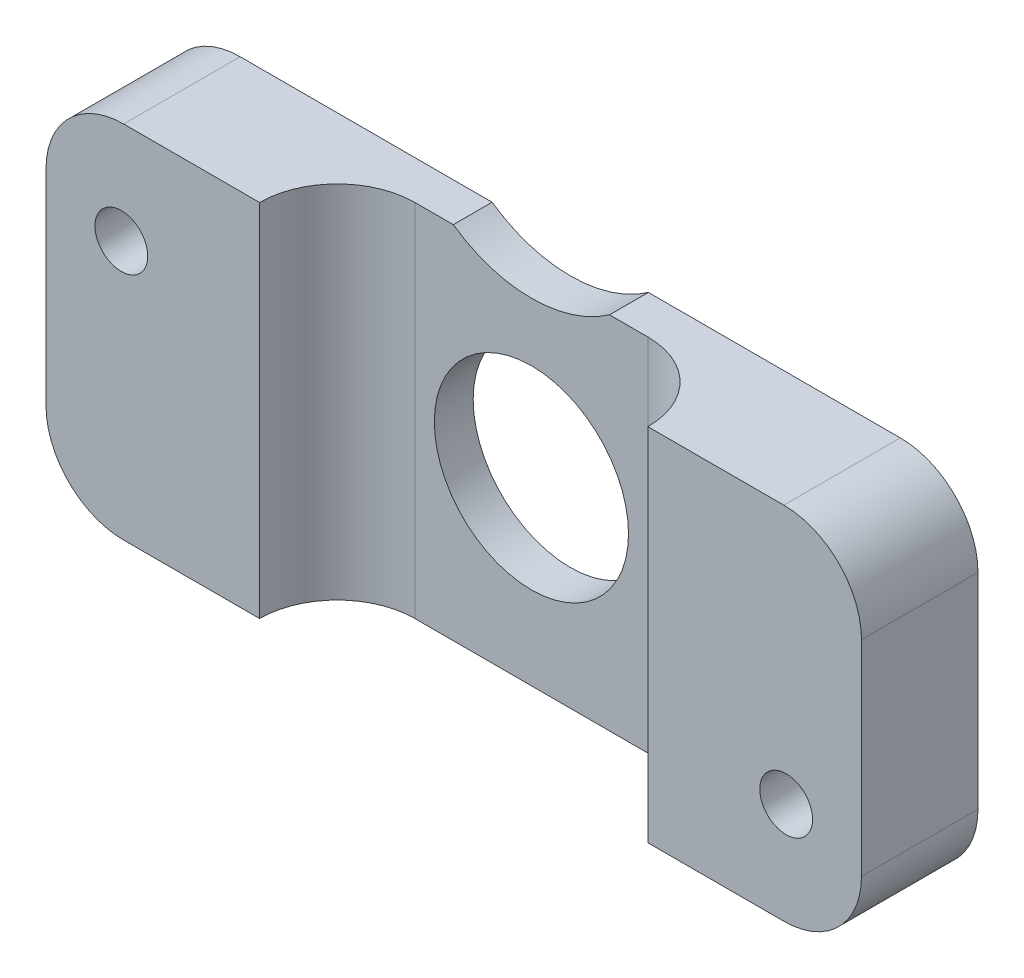
from build123d import *

# Parameters (mm, degrees)
SKETCH1_W          = 33.3375
SKETCH1_H          = 14.732
SKETCH1_R          = 3.96875
EXTRUDE1_DEPTH     = 1.5875
SKETCH3_W          = 8.73125
SKETCH3_H          = 14.732
EXTRUDE2_DEPTH     = 3.175
CUT_EXTRUDE1_START = -4.7625
SKETCH2_R          = 1.0795
SKETCH2_R_2        = 5.55625
CUT_EXTRUDE1_DEPTH = 4.7625
FILLET2_R          = 3.175
SPLIT1_DEPTH       = 4.7625


# Read off the part's stored shape, not the designer's step: Split1
with BuildPart() as part:
    # Sketch1 → Extrude1 (new body)
    with BuildSketch(Plane.XY):
        Rectangle(SKETCH1_W, SKETCH1_H)
        Circle(SKETCH1_R, mode=Mode.SUBTRACT)
    extrude(amount=EXTRUDE1_DEPTH)

    # Sketch3 → Extrude2 (add)
    with BuildSketch(Plane.XY.offset(1.5875)):
        with Locations((-12.303125, 0)):
            Rectangle(SKETCH3_W, SKETCH3_H)
        with Locations((12.303125, 0)):
            Rectangle(SKETCH3_W, SKETCH3_H)
    extrude(amount=EXTRUDE2_DEPTH)

    # Sketch2 → Cut-Extrude1 (cut)
    with BuildSketch(Plane(origin=(0, 0, 0), x_dir=(-1, 0, 0), z_dir=(0, 0, -1)).offset(CUT_EXTRUDE1_START)):
        with Locations((-13.589, -3.175)):
            Circle(SKETCH2_R)
        with Locations((13.589, 3.175)):
            Circle(SKETCH2_R)
        with Locations((0, 11.9126)):
            Circle(SKETCH2_R_2)
    extrude(amount=CUT_EXTRUDE1_DEPTH, mode=Mode.SUBTRACT)

    # Fillet2
    fillet2_edges = [part.edges().sort_by_distance(p)[0] for p in [
        (-7.9375, 0, 1.5875),
        (7.9375, 0, 1.5875),
    ]]
    fillet(fillet2_edges, radius=FILLET2_R - 0.0001)  # a hair under: the kernel refuses the full size

    # Split1 outline → Split1 (cut)
    with BuildSketch(Plane.XY):
        with BuildLine():
            Line((-16.66875, -7.366), (-13.49375, -7.366))
            ThreePointArc((-13.49375, -7.366), (-15.73881403, -6.43606403), (-16.66875, -4.191))
            Line((-16.66875, -4.191), (-16.66875, -7.366))
        make_face()
        with BuildLine():
            ThreePointArc((13.49375, 7.366), (15.73881403, 6.43606403), (16.66875, 4.191))
            Line((16.66875, 4.191), (16.66875, 7.366))
            Line((16.66875, 7.366), (13.49375, 7.366))
        make_face()
        with BuildLine():
            ThreePointArc((16.66875, -4.191), (15.73881403, -6.43606403), (13.49375, -7.366))
            Line((13.49375, -7.366), (16.66875, -7.366))
            Line((16.66875, -7.366), (16.66875, -4.191))
        make_face()
        with BuildLine():
            Line((-16.66875, 7.366), (-16.66875, 4.191))
            ThreePointArc((-16.66875, 4.191), (-15.73881403, 6.43606403), (-13.49375, 7.366))
            Line((-13.49375, 7.366), (-16.66875, 7.366))
        make_face()
    extrude(amount=SPLIT1_DEPTH, mode=Mode.SUBTRACT)


solid = part.part
